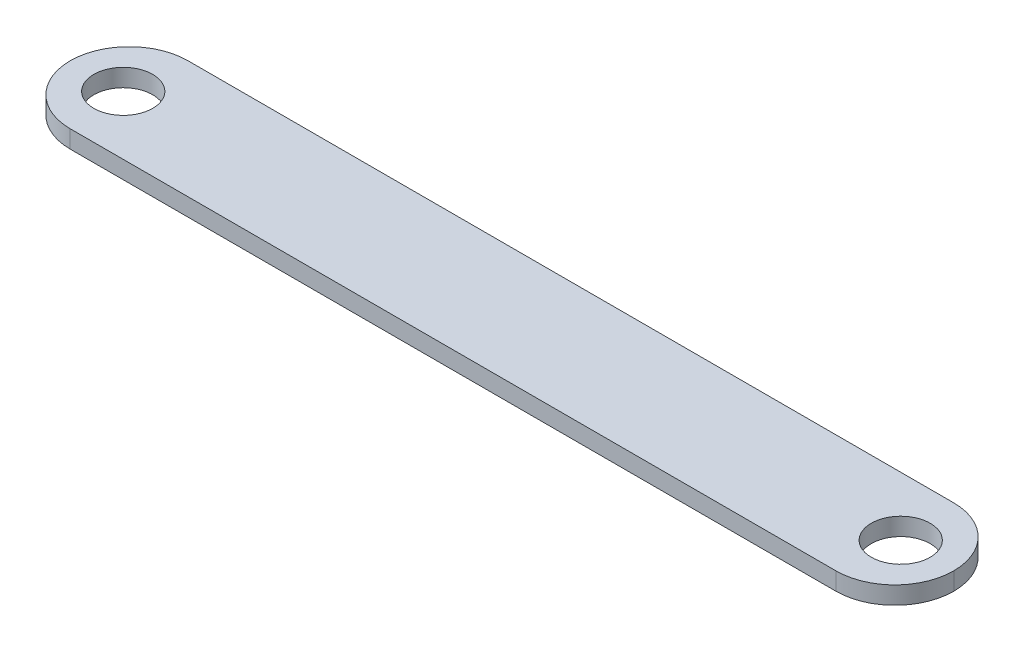
from build123d import *

# Parameters (mm, degrees)
SKETCH2_W           = 150
SKETCH2_H           = 20
BOSS_EXTRUDE1_DEPTH = 3
SKETCH3_R           = 5
CUT_EXTRUDE1_DEPTH  = 152.35719342
SKETCH4_R           = 5
CUT_EXTRUDE2_DEPTH  = 152.35719342
FILLET1_R           = 10
FILLET2_R           = 10


with BuildPart() as part:
    # Sketch2 → Boss-Extrude1 (new body)
    with BuildSketch(Plane(origin=(0, 0, 0), x_dir=(1, 0, 0), z_dir=(0, 1, 0))):
        with Locations((75, 10)):
            Rectangle(SKETCH2_W, SKETCH2_H)
    extrude(amount=BOSS_EXTRUDE1_DEPTH)

    # Sketch3 → Cut-Extrude1 (cut, through all)
    with BuildSketch(Plane(origin=(0, 3, 0), x_dir=(1, 0, 0), z_dir=(0, 1, 0))):
        with Locations(Location((9, 10, 0), (0, 0, 270))):
            Circle(SKETCH3_R)
    extrude(amount=-CUT_EXTRUDE1_DEPTH, mode=Mode.SUBTRACT)

    # Sketch4 → Cut-Extrude2 (cut, through all)
    with BuildSketch(Plane(origin=(0, 3, 0), x_dir=(1, 0, 0), z_dir=(0, 1, 0))):
        with Locations(Location((141, 10, 0), (0, 0, 270))):
            Circle(SKETCH4_R)
    extrude(amount=-CUT_EXTRUDE2_DEPTH, mode=Mode.SUBTRACT)

    # Fillet1
    fillet1_edges = [part.edges().sort_by_distance(p)[0] for p in [
        (0, 1.5, -20),
        (0, 1.5, 0),
    ]]
    fillet(fillet1_edges, radius=FILLET1_R - 0.0001)  # a hair under: the kernel refuses the full size

    # Fillet2
    fillet2_edges = [part.edges().sort_by_distance(p)[0] for p in [
        (150, 1.5, -20),
        (150, 1.5, 0),
    ]]
    fillet(fillet2_edges, radius=FILLET2_R - 0.0001)  # a hair under: the kernel refuses the full size


solid = part.part
